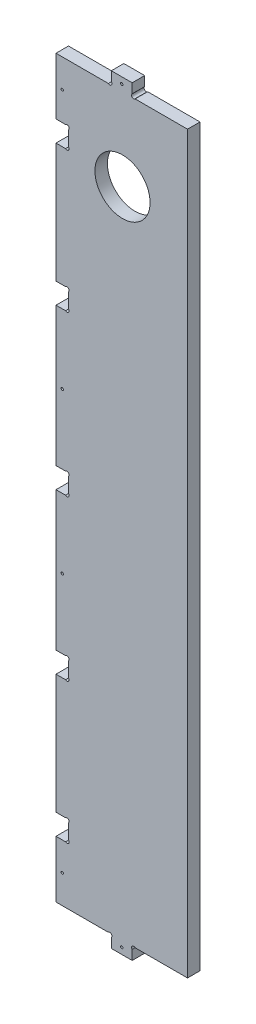
from build123d import *

# Parameters (mm, degrees)
SKETCH1_W            = 189.35
SKETCH1_H            = 1094.236516537
BOSS_EXTRUDE1_DEPTH  = 18
CAVITY1_START        = -84.195551816
CAVITY1_OUTLINE_W    = 18
CAVITY1_OUTLINE_H    = 18
CAVITY1_DEPTH        = 30
CAVITY1_START_2      = 117.922706453
CAVITY1_2_OUTLINE_W  = 18
CAVITY1_2_OUTLINE_H  = 18
CAVITY1_2_DEPTH      = 30
CAVITY1_START_3      = 347.922706453
CAVITY1_3_OUTLINE_W  = 18
CAVITY1_3_OUTLINE_H  = 18
CAVITY1_3_DEPTH      = 30
CAVITY1_START_4      = 577.922706453
CAVITY1_4_OUTLINE_W  = 18
CAVITY1_4_OUTLINE_H  = 18
CAVITY1_4_DEPTH      = 30
CAVITY1_START_5      = 780.040964722
CAVITY1_5_OUTLINE_W  = 18
CAVITY1_5_OUTLINE_H  = 18
CAVITY1_5_DEPTH      = 30
SKETCH2_W            = 79.675
SKETCH2_H            = 18
CUT_EXTRUDE1_DEPTH   = 18
SKETCH3_R            = 39.700513166
CUT_EXTRUDE2_DEPTH   = 18
M3_CLEARANCE_HOLE1_D = 3.4
SKETCH7_R            = 3
CUT_EXTRUDE3_DEPTH   = 20


# Read off the part's stored shape, not the designer's step: Cavity1
with BuildPart() as part:
    # Sketch1 → Boss-Extrude1 (new body)
    with BuildSketch(Plane.XY):
        with Locations((76.675, 362.922706452)):
            Rectangle(SKETCH1_W, SKETCH1_H)
    extrude(amount=BOSS_EXTRUDE1_DEPTH)

    # Cavity1 outline → Cavity1 (cut)
    with BuildSketch(Plane(origin=(0, 0, 0), x_dir=(1, 0, 0), z_dir=(0, 1, 0)).offset(CAVITY1_START)):
        with Locations((-9, -9)):
            Rectangle(CAVITY1_OUTLINE_W, CAVITY1_OUTLINE_H)
    extrude(amount=CAVITY1_DEPTH, mode=Mode.SUBTRACT)

    # Cavity1 2 outline → Cavity1 2 (cut)
    with BuildSketch(Plane(origin=(0, 0, 0), x_dir=(1, 0, 0), z_dir=(0, 1, 0)).offset(CAVITY1_START_2)):
        with Locations((-9, -9)):
            Rectangle(CAVITY1_2_OUTLINE_W, CAVITY1_2_OUTLINE_H)
    extrude(amount=CAVITY1_2_DEPTH, mode=Mode.SUBTRACT)

    # Cavity1 3 outline → Cavity1 3 (cut)
    with BuildSketch(Plane(origin=(0, 0, 0), x_dir=(1, 0, 0), z_dir=(0, 1, 0)).offset(CAVITY1_START_3)):
        with Locations((-9, -9)):
            Rectangle(CAVITY1_3_OUTLINE_W, CAVITY1_3_OUTLINE_H)
    extrude(amount=CAVITY1_3_DEPTH, mode=Mode.SUBTRACT)

    # Cavity1 4 outline → Cavity1 4 (cut)
    with BuildSketch(Plane(origin=(0, 0, 0), x_dir=(1, 0, 0), z_dir=(0, 1, 0)).offset(CAVITY1_START_4)):
        with Locations((-9, -9)):
            Rectangle(CAVITY1_4_OUTLINE_W, CAVITY1_4_OUTLINE_H)
    extrude(amount=CAVITY1_4_DEPTH, mode=Mode.SUBTRACT)

    # Cavity1 5 outline → Cavity1 5 (cut)
    with BuildSketch(Plane(origin=(0, 0, 0), x_dir=(1, 0, 0), z_dir=(0, 1, 0)).offset(CAVITY1_START_5)):
        with Locations((-9, -9)):
            Rectangle(CAVITY1_5_OUTLINE_W, CAVITY1_5_OUTLINE_H)
    extrude(amount=CAVITY1_5_DEPTH, mode=Mode.SUBTRACT)

    # Sketch2 → Cut-Extrude1 (cut)
    with BuildSketch(Plane.XY.offset(18)):
        with Locations((21.8375, -175.195551816)):
            Rectangle(SKETCH2_W, SKETCH2_H)
        with Locations((131.5125, -175.195551816)):
            Rectangle(SKETCH2_W, SKETCH2_H)
        with Locations((21.8375, 901.040964721)):
            Rectangle(SKETCH2_W, SKETCH2_H)
        with Locations((131.5125, 901.040964721)):
            Rectangle(SKETCH2_W, SKETCH2_H)
    extrude(amount=-CUT_EXTRUDE1_DEPTH, mode=Mode.SUBTRACT)

    # Sketch3 → Cut-Extrude2 (cut)
    with BuildSketch(Plane.XY.offset(18)):
        with Locations((77.75, 773.505430817)):
            Circle(SKETCH3_R)
    extrude(amount=-CUT_EXTRUDE2_DEPTH, mode=Mode.SUBTRACT)

    # M3 Clearance Hole1 (through all)
    with Locations(Plane.XY.offset(18)):
        with Locations((-9, 851.040964721), (-9, -125.195551816), (-9, 477.922706453), (-9, 247.922706453), (76.675, 901.040964721), (76.675, -175.195551816)):
            Hole(M3_CLEARANCE_HOLE1_D / 2)

    # Sketch7 → Cut-Extrude3 (cut)
    with BuildSketch(Plane(origin=(0, 0, 0), x_dir=(-1, 0, 0), z_dir=(0, 0, -1))):
        with Locations((2.121320344, -56.31687216)):
            Circle(SKETCH7_R)
        with Locations((2.121320344, -82.074231473)):
            Circle(SKETCH7_R)
        with Locations((2.121320344, 145.80312784)):
            Circle(SKETCH7_R)
        with Locations((2.121320344, 120.045768527)):
            Circle(SKETCH7_R)
        with Locations((2.121320344, 605.799644378)):
            Circle(SKETCH7_R)
        with Locations((2.121320344, 580.042285065)):
            Circle(SKETCH7_R)
        with Locations((2.121320344, 807.919644378)):
            Circle(SKETCH7_R)
        with Locations((2.121320344, 782.162285065)):
            Circle(SKETCH7_R)
        with Locations((2.121320344, 375.801386109)):
            Circle(SKETCH7_R)
        with Locations((2.121320344, 350.044026796)):
            Circle(SKETCH7_R)
        with Locations((-59.553679656, -168.31687216)):
            Circle(SKETCH7_R)
        with Locations((-93.796320344, -168.31687216)):
            Circle(SKETCH7_R)
        with Locations((-93.796320344, 894.162285065)):
            Circle(SKETCH7_R)
        with Locations((-59.553679656, 894.162285065)):
            Circle(SKETCH7_R)
    extrude(amount=-CUT_EXTRUDE3_DEPTH, mode=Mode.SUBTRACT)


solid = part.part
